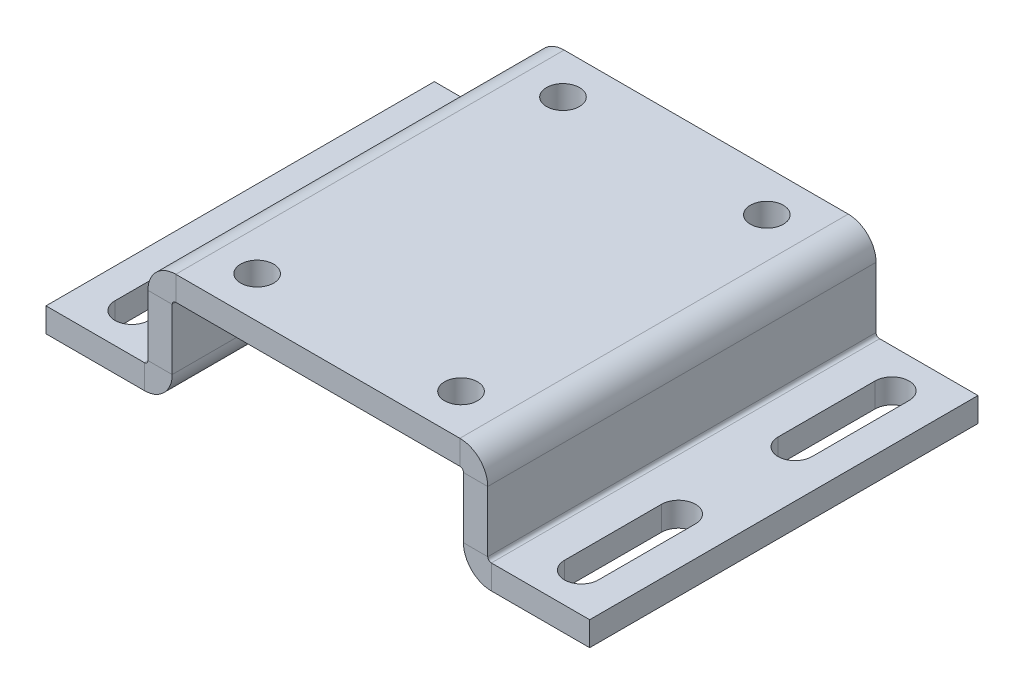
from build123d import *

# Parameters (mm, degrees)
SM_BASE_FLANGE_1_DEPTH  = 80
HOLE_WIZARD_6_8_6_8_2_D = 6.8
CUT_EXTRUDE_3_DEPTH     = 5
MIRROR_5_COPY_1_D       = 6.8
MIRROR_5_COPY_2_DEPTH   = 5


# Sheet-metal steps are written as plain solids
with BuildPart() as part:
    # 草图3 → 基体-法兰1 (new body)
    with BuildSketch(Plane.XY):
        with BuildLine():
            Line((56, 0), (35.7366, 0))
            ThreePointArc((35.7366, 0), (35.215745145, 0.215745145), (35, 0.7366))
            Line((35, 0.7366), (35, 13.2634))
            ThreePointArc((35, 13.2634), (33.319788761, 17.319788761), (29.2634, 19))
            Line((29.2634, 19), (-29.2634, 19))
            ThreePointArc((-29.2634, 19), (-33.319788761, 17.319788761), (-35, 13.2634))
            Line((-35, 13.2634), (-35, 0.7366))
            ThreePointArc((-35, 0.7366), (-35.215745145, 0.215745145), (-35.7366, 0))
            Line((-35.7366, 0), (-56, 0))
            Line((-56, 0), (-56, -5))
            Line((-56, -5), (-35.7366, -5))
            ThreePointArc((-35.7366, -5), (-31.680211239, -3.319788761), (-30, 0.7366))
            Line((-30, 0.7366), (-30, 13.2634))
            ThreePointArc((-30, 13.2634), (-29.784254855, 13.784254855), (-29.2634, 14))
            Line((-29.2634, 14), (29.2634, 14))
            ThreePointArc((29.2634, 14), (29.784254855, 13.784254855), (30, 13.2634))
            Line((30, 13.2634), (30, 0.7366))
            ThreePointArc((30, 0.7366), (31.680211239, -3.319788761), (35.7366, -5))
            Line((35.7366, -5), (56, -5))
            Line((56, -5), (56, 0))
        make_face()
    extrude(amount=SM_BASE_FLANGE_1_DEPTH)

    # Ø6.8 (6.8) 直径孔2 (through all)
    with Locations(Plane(origin=(21, 19, 8.5), x_dir=(0, 0, 1), z_dir=(0, 1, 0))):
        with Locations((0, 0)):
            hole_wizard_6_8_6_8_2 = Hole(HOLE_WIZARD_6_8_6_8_2_D / 2)

    # 草图10 → 切除-拉伸3 (cut)
    with BuildSketch(Plane(origin=(0, 0, 0), x_dir=(1, 0, 0), z_dir=(0, 1, 0))):
        with BuildLine():
            Line((49.8, -52), (49.8, -72))
            ThreePointArc((49.8, -72), (46.3, -75.5), (42.8, -72))
            Line((42.8, -72), (42.8, -52))
            ThreePointArc((42.8, -52), (46.3, -48.5), (49.8, -52))
        make_face()
    cut_extrude_3 = extrude(amount=-CUT_EXTRUDE_3_DEPTH, mode=Mode.SUBTRACT)

    # 镜向4: Ø6.8 (6.8) 直径孔2, 切除-拉伸3 across plane
    add(hole_wizard_6_8_6_8_2.mirror(Plane(origin=(0, 0, 40), x_dir=(1, 0, 0), z_dir=(0, 0, -1))), mode=Mode.SUBTRACT)
    add(cut_extrude_3.mirror(Plane(origin=(0, 0, 40), x_dir=(1, 0, 0), z_dir=(0, 0, -1))), mode=Mode.SUBTRACT)

    # 镜向5: Ø6.8 (6.8) 直径孔2, 切除-拉伸3 across plane
    add(hole_wizard_6_8_6_8_2.mirror(Plane(origin=(0, 0, 0), x_dir=(0, 0, 1), z_dir=(1, 0, 0))), mode=Mode.SUBTRACT)
    add(cut_extrude_3.mirror(Plane(origin=(0, 0, 0), x_dir=(0, 0, 1), z_dir=(1, 0, 0))), mode=Mode.SUBTRACT)

    # 镜向5 copy 1 (through all)
    with Locations(Plane(origin=(-21, 19, 71.5), x_dir=(0, 0, -1), z_dir=(0, 1, 0))):
        with Locations((0, 0)):
            Hole(MIRROR_5_COPY_1_D / 2)

    # 镜向5 copy 2 sketch → 镜向5 copy 2 (cut)
    with BuildSketch(Plane(origin=(0, 0, 80), x_dir=(-1, 0, 0), z_dir=(0, 1, 0))):
        with BuildLine():
            Line((49.8, -52), (49.8, -72))
            ThreePointArc((49.8, -72), (46.3, -75.5), (42.8, -72))
            Line((42.8, -72), (42.8, -52))
            ThreePointArc((42.8, -52), (46.3, -48.5), (49.8, -52))
        make_face()
    extrude(amount=-MIRROR_5_COPY_2_DEPTH, mode=Mode.SUBTRACT)


solid = part.part
